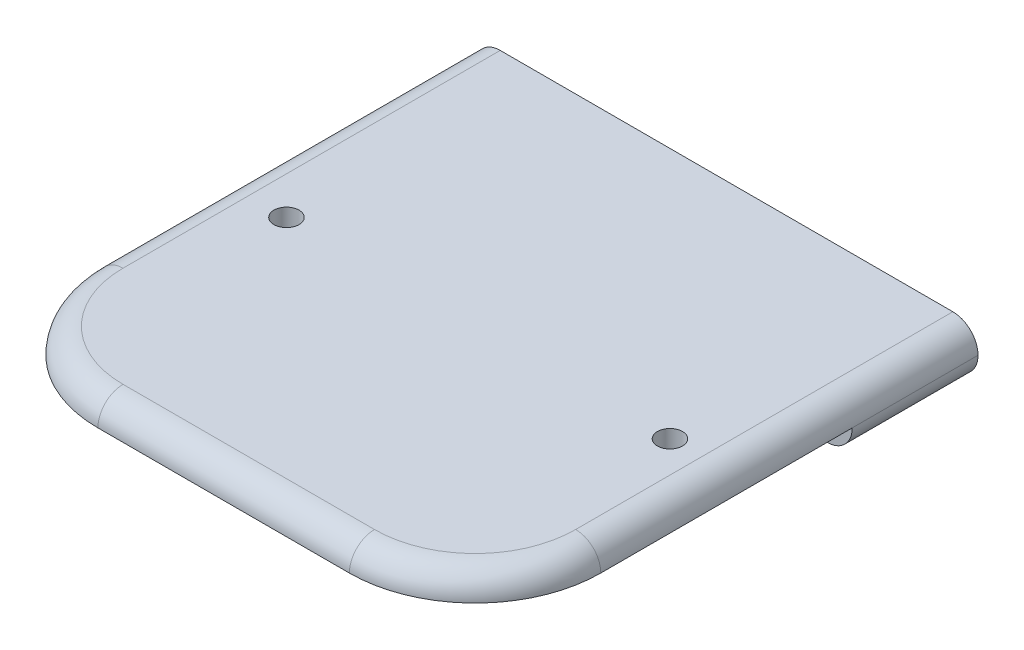
from build123d import *

# Parameters (mm, degrees)
SKETCH_1_W          = 40
SKETCH_1_H          = 4
EXTRUDE_1_DEPTH     = 40
SKETCH_3_W          = 40
SKETCH_3_H          = 30
CUT_EXTRUDE_1_DEPTH = 2
SKETCH_4_R          = 1
CUT_EXTRUDE_2_DEPTH = 4
SKETCH_6_R          = 1
CUT_EXTRUDE_3_DEPTH = 4
FILLET_4_R          = 10
FILLET_5_R          = 10
FILLET_6_R          = 2
FILLET_7_R          = 2
FILLET_8_R          = 2


with BuildPart() as part:
    # ｽｹｯﾁ1 → ﾎﾞｽ - 押し出し1 (new body)
    with BuildSketch(Plane.XY):
        with Locations((20, 2)):
            Rectangle(SKETCH_1_W, SKETCH_1_H)
    extrude(amount=EXTRUDE_1_DEPTH)

    # ｽｹｯﾁ3 → ｶｯﾄ - 押し出し1 (cut)
    with BuildSketch(Plane.XZ):
        with Locations((20, 25)):
            Rectangle(SKETCH_3_W, SKETCH_3_H)
    extrude(amount=-CUT_EXTRUDE_1_DEPTH, mode=Mode.SUBTRACT)

    # ｽｹｯﾁ4 → ｶｯﾄ - 押し出し2 (cut)
    with BuildSketch(Plane(origin=(0, 4, 0), x_dir=(1, 0, 0), z_dir=(0, 1, 0))):
        with Locations(Location((35.5, -20, 0), (0, 0, 270))):
            Circle(SKETCH_4_R)
    extrude(amount=-CUT_EXTRUDE_2_DEPTH, mode=Mode.SUBTRACT)

    # ｽｹｯﾁ6 → ｶｯﾄ - 押し出し3 (cut)
    with BuildSketch(Plane(origin=(0, 4, 0), x_dir=(1, 0, 0), z_dir=(0, 1, 0))):
        with Locations(Location((5, -20, 0), (0, 0, 270))):
            Circle(SKETCH_6_R)
    extrude(amount=-CUT_EXTRUDE_3_DEPTH, mode=Mode.SUBTRACT)

    # ﾌｨﾚｯﾄ4
    fillet_4_edges = [part.edges().sort_by_distance(p)[0] for p in [
        (40, 3, 40),
    ]]
    fillet(fillet_4_edges, radius=FILLET_4_R)

    # ﾌｨﾚｯﾄ5
    fillet_5_edges = [part.edges().sort_by_distance(p)[0] for p in [
        (0, 3, 40),
    ]]
    fillet(fillet_5_edges, radius=FILLET_5_R)

    # ﾌｨﾚｯﾄ6
    fillet_6_edges = [part.edges().sort_by_distance(p)[0] for p in [
        (0, 4, 15),
        (2.928932188, 4, 37.071067812),
        (20, 4, 40),
        (37.071067812, 4, 37.071067812),
        (40, 4, 15),
    ]]
    fillet(fillet_6_edges, radius=FILLET_6_R - 0.0001)  # a hair under: the kernel refuses the full size

    # ﾌｨﾚｯﾄ7
    fillet_7_edges = [part.edges().sort_by_distance(p)[0] for p in [
        (40, 0, 5),
    ]]
    fillet(fillet_7_edges, radius=FILLET_7_R)

    # ﾌｨﾚｯﾄ8
    fillet_8_edges = [part.edges().sort_by_distance(p)[0] for p in [
        (0, 0, 5),
    ]]
    fillet(fillet_8_edges, radius=FILLET_8_R)


solid = part.part
